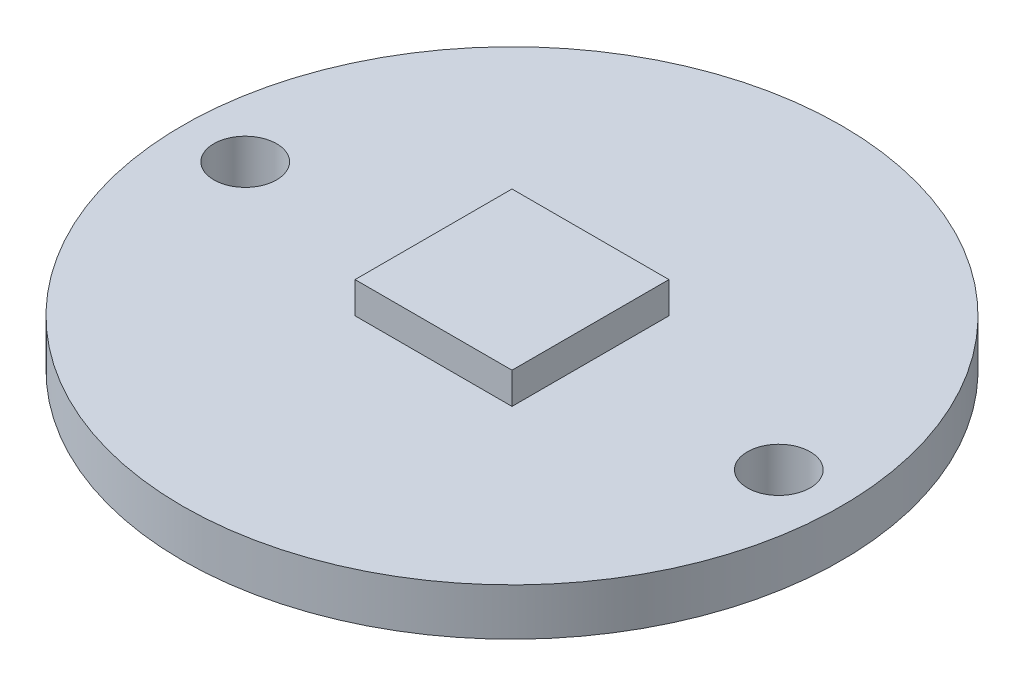
from build123d import *

# Parameters (mm, degrees)
SKETCH1_R           = 10.5
SKETCH1_R_2         = 1
BOSS_EXTRUDE1_DEPTH = 1.5
SKETCH2_W           = 5
SKETCH2_H           = 5
BOSS_EXTRUDE2_DEPTH = 1


with BuildPart() as part:
    # Sketch1 → Boss-Extrude1 (new body)
    with BuildSketch(Plane(origin=(0, 0, 0), x_dir=(1, 0, 0), z_dir=(0, 1, 0))):
        Circle(SKETCH1_R)
        with Locations((-8.5, 0)):
            Circle(SKETCH1_R_2, mode=Mode.SUBTRACT)
        with Locations((8.5, 0)):
            Circle(SKETCH1_R_2, mode=Mode.SUBTRACT)
    extrude(amount=BOSS_EXTRUDE1_DEPTH)

    # Sketch2 → Boss-Extrude2 (add)
    with BuildSketch(Plane(origin=(0, 1.5, 0), x_dir=(1, 0, 0), z_dir=(0, 1, 0))):
        Rectangle(SKETCH2_W, SKETCH2_H)
    extrude(amount=BOSS_EXTRUDE2_DEPTH)


solid = part.part
